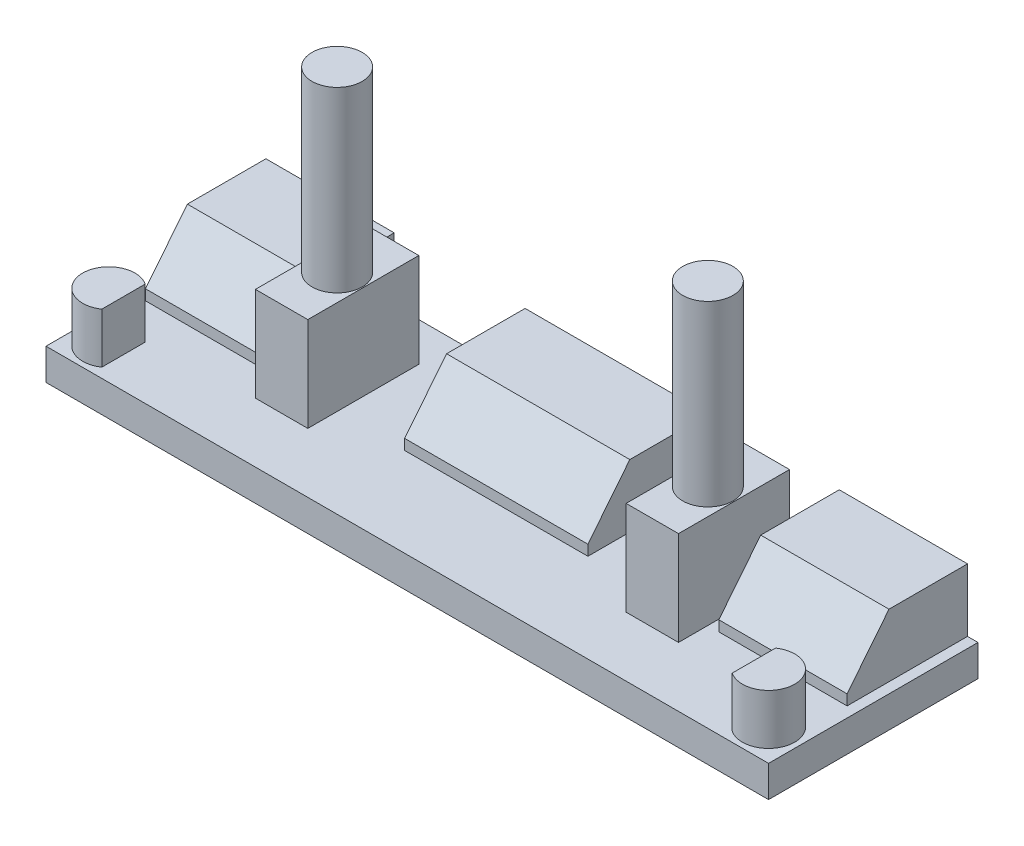
from build123d import *
from OCP.BRepFilletAPI import BRepFilletAPI_MakeChamfer

# Parameters (mm, degrees)
SKETCH_1_W             = 69
SKETCH_1_H             = 20
EXTRUDE_1_DEPTH        = 3
FILLET_1_R             = 1
SKETCH_3_W             = 12.25
SKETCH_3_H             = 11.5
SKETCH_3_W_2           = 17.5
EXTRUDE_2_DEPTH        = 6
SKETCH_4_W             = 5
SKETCH_4_H             = 10.6
EXTRUDE_3_DEPTH        = 9
SKETCH_5_R             = 2.4
EXTRUDE_4_DEPTH        = 17
CHAMFER_1_SIZE         = 4
CHAMFER_1_SIZE2        = 5
EXTRUDE_5_DEPTH        = 4.8
MIRROR_START           = 3
MIRROR_1_OUTLINE_W     = 69
MIRROR_1_OUTLINE_H     = 20
MIRROR_1_DEPTH         = 3
MIRROR_START_2         = 6
MIRROR_1_2_OUTLINE_W   = 5
MIRROR_1_2_OUTLINE_H   = 10.6
MIRROR_1_2_DEPTH       = 9
MIRROR_START_3         = 15
MIRROR_1_3_OUTLINE_R   = 2.4
MIRROR_1_3_DEPTH       = 17
MIRROR_1_4_OUTLINE_W   = 12.25
MIRROR_1_4_OUTLINE_H   = 11.5
MIRROR_1_4_OUTLINE_W_2 = 17.5
MIRROR_1_4_DEPTH       = 1
MIRROR_START_4         = 6.49884
MIRROR_1_5_DEPTH       = 4.30116
MIRROR_START_5         = 25.75
MIRROR_1_6_DEPTH       = 17.5
MIRROR_START_6         = 1
MIRROR_1_7_DEPTH       = 12.25
MIRROR_START_7         = 55.75
MIRROR_1_8_DEPTH       = 12.25
SKETCH_7_W             = 69
SKETCH_7_H             = 20
CUT_EXTRUDE_1_DEPTH    = 78.472575793


with BuildPart() as part:
    # ｽｹｯﾁ1 → ﾎﾞｽ - 押し出し1 (new body)
    with BuildSketch(Plane(origin=(0, 0, 0), x_dir=(1, 0, 0), z_dir=(0, 1, 0))):
        with Locations((34.5, 10)):
            Rectangle(SKETCH_1_W, SKETCH_1_H)
    extrude(amount=EXTRUDE_1_DEPTH)

    # ﾌｨﾚｯﾄ1
    fillet_1_edges = [part.edges().sort_by_distance(p)[0] for p in [
        (0, 1.5, -20),
        (69, 1.5, -20),
        (69, 1.5, 0),
        (0, 1.5, 0),
    ]]
    fillet(fillet_1_edges, radius=FILLET_1_R)

    # ｽｹｯﾁ3 → ﾎﾞｽ - 押し出し2 (add)
    with BuildSketch(Plane.XZ):
        with Locations((7.125, -14.25)):
            Rectangle(SKETCH_3_W, SKETCH_3_H)
        with Locations((34.5, -14.25)):
            Rectangle(SKETCH_3_W_2, SKETCH_3_H)
        with Locations((61.875, -14.25)):
            Rectangle(SKETCH_3_W, SKETCH_3_H)
    extrude(amount=EXTRUDE_2_DEPTH)

    # ｽｹｯﾁ4 → ﾎﾞｽ - 押し出し3 (add)
    with BuildSketch(Plane.XZ):
        with Locations((52.2, -11)):
            Rectangle(SKETCH_4_W, SKETCH_4_H)
        with Locations((16.8, -11)):
            Rectangle(SKETCH_4_W, SKETCH_4_H)
    extrude(amount=EXTRUDE_3_DEPTH)

    # ｽｹｯﾁ5 → ﾎﾞｽ - 押し出し4 (add)
    with BuildSketch(Plane.XZ.offset(9)):
        with Locations(Location((16.8, -11, 0), (0, 0, 270))):
            Circle(SKETCH_5_R)
        with Locations(Location((52.2, -11, 0), (0, 0, 90))):
            Circle(SKETCH_5_R)
    extrude(amount=EXTRUDE_4_DEPTH)

    # 面取り1: one chamfer whose edges measure the first distance from different faces: ONE call of the kernel's chamfer builder (chamfer() names one face for all edges)
    chamfer_1_edges_1 = [part.edges().sort_by_distance(p)[0] for p in [
        (7.125, -6, -8.5),
    ]]
    chamfer_1_side_1 = [part.faces().sort_by_distance(p)[0] for p in [
        (7.125, -3, -8.5),
    ]]
    chamfer_1_edges_2 = [part.edges().sort_by_distance(p)[0] for p in [
        (34.5, -6, -8.5),
    ]]
    chamfer_1_side_2 = [part.faces().sort_by_distance(p)[0] for p in [
        (34.5, -3, -8.5),
    ]]
    chamfer_1_edges_3 = [part.edges().sort_by_distance(p)[0] for p in [
        (61.875, -6, -8.5),
    ]]
    chamfer_1_side_3 = [part.faces().sort_by_distance(p)[0] for p in [
        (61.875, -3, -8.5),
    ]]
    chamfer_1 = BRepFilletAPI_MakeChamfer(part.part.solid().wrapped)
    for e in chamfer_1_edges_1:
        chamfer_1.Add(CHAMFER_1_SIZE, CHAMFER_1_SIZE2, e.wrapped, chamfer_1_side_1[0].wrapped)  # the first distance lies on this face
    for e in chamfer_1_edges_2:
        chamfer_1.Add(CHAMFER_1_SIZE, CHAMFER_1_SIZE2, e.wrapped, chamfer_1_side_2[0].wrapped)  # the first distance lies on this face
    for e in chamfer_1_edges_3:
        chamfer_1.Add(CHAMFER_1_SIZE, CHAMFER_1_SIZE2, e.wrapped, chamfer_1_side_3[0].wrapped)  # the first distance lies on this face
    add(Compound.cast(chamfer_1.Shape()), mode=Mode.REPLACE)

    # ｽｹｯﾁ6 → ﾎﾞｽ - 押し出し5 (add)
    with BuildSketch(Plane.XZ):
        with BuildLine():
            Line((4.4, -5.071231518), (4.4, -0.928768482))
            ThreePointArc((4.4, -0.928768482), (0.5, -3), (4.4, -5.071231518))
        make_face()
        with BuildLine():
            ThreePointArc((68.5, -3), (67.17260394, -0.792059783), (64.6, -0.928768482))
            Line((64.6, -0.928768482), (64.6, -5.071231518))
            ThreePointArc((64.6, -5.071231518), (67.17260394, -5.207940217), (68.5, -3))
        make_face()
    extrude(amount=EXTRUDE_5_DEPTH)

    # ﾐﾗｰ1: read off the stored shape, not the designer's step
    # ﾐﾗｰ1 outline → ﾐﾗｰ1 (add)
    with BuildSketch(Plane(origin=(0, 0, 0), x_dir=(1, 0, 0), z_dir=(0, 1, 0)).offset(MIRROR_START)):
        with Locations((34.5, 10)):
            Rectangle(MIRROR_1_OUTLINE_W, MIRROR_1_OUTLINE_H)
    extrude(amount=MIRROR_1_DEPTH)

    # Mirror 1 2 outline → Mirror 1 2 (add)
    with BuildSketch(Plane(origin=(0, 0, 0), x_dir=(1, 0, 0), z_dir=(0, 1, 0)).offset(MIRROR_START_2)):
        with Locations((52.2, 11)):
            Rectangle(MIRROR_1_2_OUTLINE_W, MIRROR_1_2_OUTLINE_H)
        with Locations((16.8, 11)):
            Rectangle(MIRROR_1_2_OUTLINE_W, MIRROR_1_2_OUTLINE_H)
    extrude(amount=MIRROR_1_2_DEPTH)

    # Mirror 1 3 outline → Mirror 1 3 (add)
    with BuildSketch(Plane(origin=(0, 0, 0), x_dir=(1, 0, 0), z_dir=(0, 1, 0)).offset(MIRROR_START_3)):
        with Locations((16.8, 11)):
            Circle(MIRROR_1_3_OUTLINE_R)
        with Locations((52.2, 11)):
            Circle(MIRROR_1_3_OUTLINE_R)
    extrude(amount=MIRROR_1_3_DEPTH)

    # Mirror 1 4 outline → Mirror 1 4 (add)
    with BuildSketch(Plane(origin=(0, 0, 0), x_dir=(1, 0, 0), z_dir=(0, 1, 0)).offset(MIRROR_START_2)):
        with Locations((7.125, 14.25)):
            Rectangle(MIRROR_1_4_OUTLINE_W, MIRROR_1_4_OUTLINE_H)
        with Locations((61.875, 14.25)):
            Rectangle(MIRROR_1_4_OUTLINE_W, MIRROR_1_4_OUTLINE_H)
        with Locations((34.5, 14.25)):
            Rectangle(MIRROR_1_4_OUTLINE_W_2, MIRROR_1_4_OUTLINE_H)
        with BuildLine():
            ThreePointArc((4.4, 5.071231518), (0.5, 3), (4.4, 0.928768482))
            Line((4.4, 0.928768482), (4.4, 5.071231518))
        make_face()
        with BuildLine():
            ThreePointArc((64.6, 0.928768482), (68.5, 3), (64.6, 5.071231518))
            Line((64.6, 5.071231518), (64.6, 0.928768482))
        make_face()
    extrude(amount=MIRROR_1_4_DEPTH)

    # Mirror 1 5 outline → Mirror 1 5 (add)
    with BuildSketch(Plane(origin=(0, 0, 0), x_dir=(1, 0, 0), z_dir=(0, 1, 0)).offset(MIRROR_START_4)):
        with BuildLine():
            ThreePointArc((4.4, 5.071231518), (0.5, 3), (4.4, 0.928768482))
            Line((4.4, 0.928768482), (4.4, 5.071231518))
        make_face()
        with BuildLine():
            ThreePointArc((64.6, 0.928768482), (68.5, 3), (64.6, 5.071231518))
            Line((64.6, 5.071231518), (64.6, 0.928768482))
        make_face()
    extrude(amount=MIRROR_1_5_DEPTH)

    # Mirror 1 6 outline → Mirror 1 6 (add)
    with BuildSketch(Plane.YZ.offset(MIRROR_START_5)):
        Polygon((7, -20), (12, -20), (12, -12.5), (7, -8.5), align=None)
    extrude(amount=MIRROR_1_6_DEPTH)

    # Mirror 1 7 outline → Mirror 1 7 (add)
    with BuildSketch(Plane.YZ.offset(MIRROR_START_6)):
        Polygon((7, -20), (12, -20), (12, -12.5), (7, -8.5), align=None)
    extrude(amount=MIRROR_1_7_DEPTH)

    # Mirror 1 8 outline → Mirror 1 8 (add)
    with BuildSketch(Plane.YZ.offset(MIRROR_START_7)):
        Polygon((7, -20), (12, -20), (12, -12.5), (7, -8.5), align=None)
    extrude(amount=MIRROR_1_8_DEPTH)

    # ｽｹｯﾁ7 → ｶｯﾄ - 押し出し1 (cut, through all)
    with BuildSketch(Plane.XZ.offset(-3)):
        with Locations((34.5, -10)):
            Rectangle(SKETCH_7_W, SKETCH_7_H)
    extrude(amount=CUT_EXTRUDE_1_DEPTH, mode=Mode.SUBTRACT)


solid = part.part
